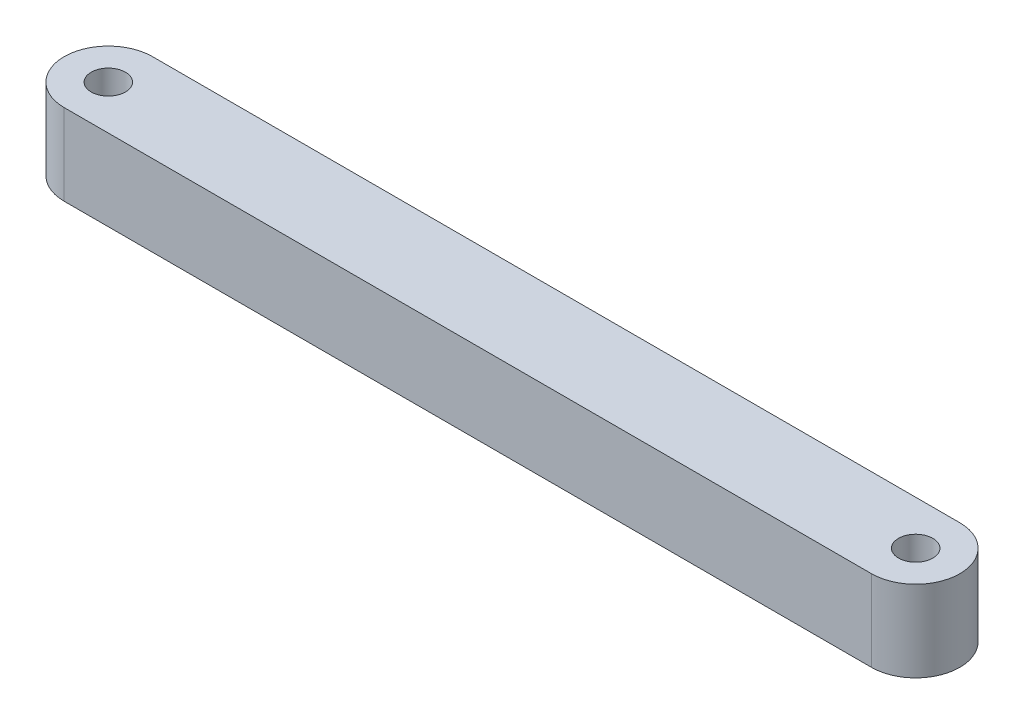
from build123d import *

# Parameters (mm, degrees)
BOSS_EXTRUDE1_DEPTH = 10.2108
SKETCH2_R           = 2.159
CUT_EXTRUDE1_DEPTH  = 108.784944518


with BuildPart() as part:
    # Sketch1 → Boss-Extrude1 (new body)
    with BuildSketch(Plane(origin=(0, 0, 0), x_dir=(1, 0, 0), z_dir=(0, 1, 0))):
        with BuildLine():
            Line((0, 5.55625), (101.6, 5.55625))
            ThreePointArc((101.6, 5.55625), (107.15625, 0), (101.6, -5.55625))
            Line((101.6, -5.55625), (0, -5.55625))
            ThreePointArc((0, -5.55625), (-5.55625, 0), (0, 5.55625))
        make_face()
    extrude(amount=BOSS_EXTRUDE1_DEPTH)

    # Sketch2 → Cut-Extrude1 (cut, through all)
    with BuildSketch(Plane(origin=(0, 10.2108, 0), x_dir=(1, 0, 0), z_dir=(0, 1, 0))):
        with Locations((101.6, 0)):
            Circle(SKETCH2_R)
        Circle(SKETCH2_R)
    extrude(amount=-CUT_EXTRUDE1_DEPTH, mode=Mode.SUBTRACT)


solid = part.part
